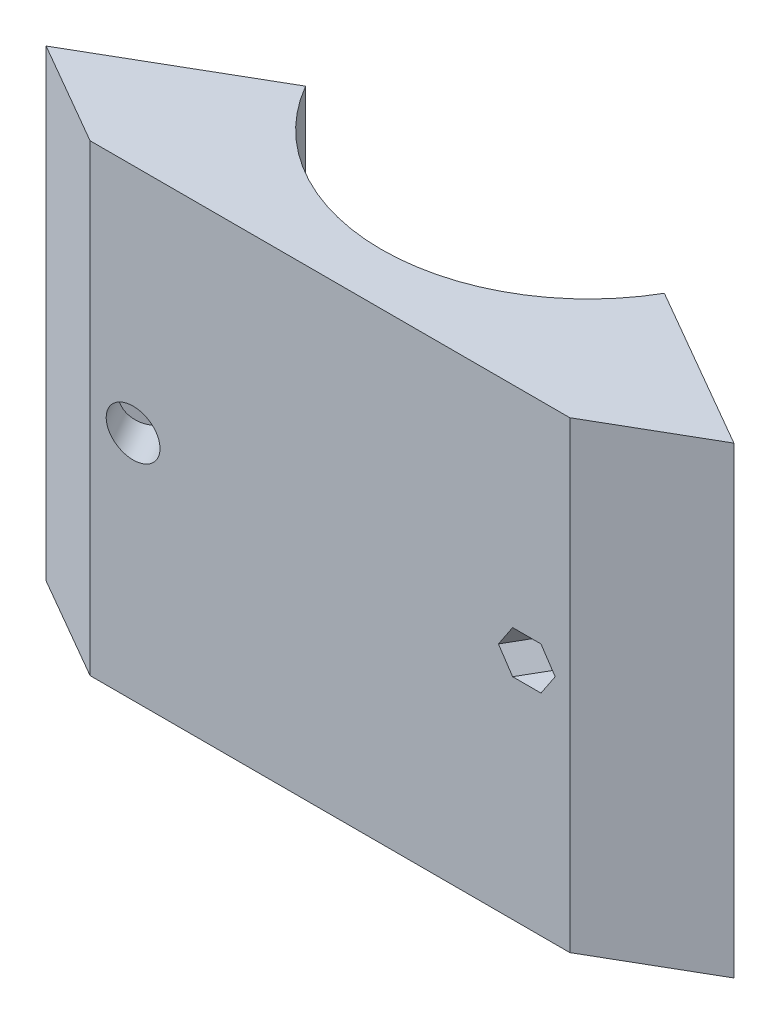
from build123d import *

# Parameters (mm, degrees)
BOSS_EXTRUDE1_DEPTH = 57.15
CUT_EXTRUDE1_START  = -16.000000004
SKETCH3_R           = 3.499999985
CUT_EXTRUDE1_DEPTH  = 105.568182472


with BuildPart() as part:
    # Sketch1 → Boss-Extrude1 (new, symmetric)
    with BuildSketch(Plane(origin=(0, 0, 0), x_dir=(1, 0, 0), z_dir=(0, 1, 0))):
        with BuildLine():
            Line((-44.258055055, -25.5524), (-84.849935901, -48.988133333))
            Line((-84.849935901, -48.988133333), (-59.186716436, -63.8048))
            Line((-59.186716436, -63.8048), (59.186716436, -63.8048))
            Line((59.186716436, -63.8048), (84.849935901, -48.988133333))
            Line((84.849935901, -48.988133333), (44.258055055, -25.5524))
            ThreePointArc((44.258055055, -25.5524), (0, -51.1048), (-44.258055055, -25.5524))
        make_face()
    extrude(amount=BOSS_EXTRUDE1_DEPTH, both=True)

    # Sketch2 → Cut-Revolve7 (revolve, cut)
    with BuildSketch(Plane(origin=(0, 0, 0), x_dir=(1, 0, 0), z_dir=(0, 1, 0))):
        Polygon((-43.878504985, -64.929800036), (-61.024306886, -35.232400008), (-64.055395786, -36.9824), (-46.909593885, -66.679800029), align=None)
    cut_revolve7 = revolve(axis=Axis((-64.055395786, 0, 36.9824), (0.4999999999999998, 0, 0.8660254037844388)), mode=Mode.SUBTRACT)

    # Sketch2<7> → Cut-Revolve8 (revolve, cut)
    with BuildSketch(Plane(origin=(0, 0, 0), x_dir=(1, 0, 0), z_dir=(0, 1, 0))):
        Polygon((-44.528024059, -63.8048), (-41.929947764, -63.8048), (-49.075749726, -51.427907942), (-51.024306947, -52.552907978), align=None)
    revolve(axis=Axis((-64.055395786, 0, 36.9824), (0.4999999999999998, 0, 0.8660254037844388)), mode=Mode.SUBTRACT)

    # Mirror1: Cut-Revolve7 across plane
    add(cut_revolve7.mirror(Plane(origin=(0, 0, 0), x_dir=(0, 0, 1), z_dir=(1, 0, 0))), mode=Mode.SUBTRACT)

    # Sketch3 → Cut-Extrude1 (cut, through all)
    with BuildSketch(Plane(origin=(0, 0, 0), x_dir=(-0.8660254037844386, 0, -0.5000000000000001), z_dir=(0.5000000000000001, 0, -0.8660254037844386)).offset(CUT_EXTRUDE1_START)):
        Polygon((-76.995888937, 5.250000041), (-80.026977874, 0), (-76.995888937, -5.250000041), (-70.933711063, -5.250000041), (-67.902622126, 0), (-70.933711063, 5.250000041), align=None)
        with Locations((-73.9648, 0)):
            Circle(SKETCH3_R, mode=Mode.SUBTRACT)
    extrude(amount=-CUT_EXTRUDE1_DEPTH, mode=Mode.SUBTRACT)


solid = part.part
